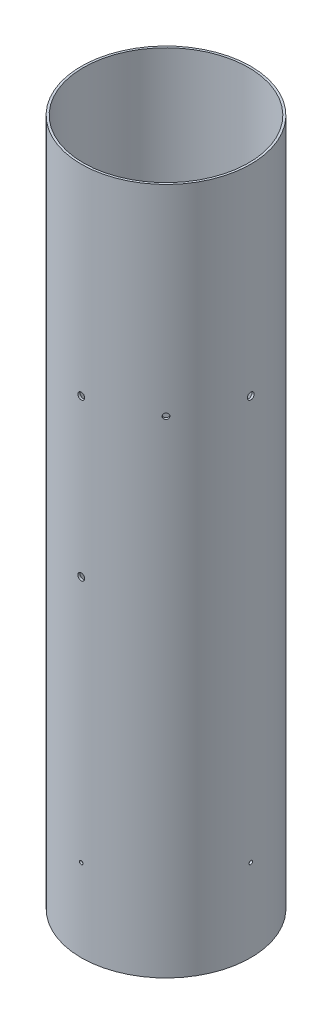
from build123d import *

# Parameters (mm, degrees)
SKETCH2_R                      = 78.359
SKETCH2_R_2                    = 76.3651
BOSS_EXTRUDE1_DEPTH            = 635
SKETCH4_R                      = 3.175
CUT_EXTRUDE2_DEPTH             = 645.59697933
CIRPATTERN2_COUNT              = 4
CUT_EXTRUDE3_REACH             = 664.58
CUT_EXTRUDE3_END_RADIUS        = 76.3651
SKETCH5_R                      = 2.57937
CUT_EXTRUDE3_DIRECTION_2_DEPTH = 663.580045892
CUT_EXTRUDE4_DEPTH             = 645.596979453
CUT_EXTRUDE4_DEPTH_BACK        = 645.596979453
SKETCH6_R                      = 3.175
CIRPATTERN3_COUNT              = 4


with BuildPart() as part:
    # Sketch2 → Boss-Extrude1 (new body)
    with BuildSketch(Plane(origin=(0, 0, 0), x_dir=(1, 0, 0), z_dir=(0, 1, 0))):
        Circle(SKETCH2_R)
        Circle(SKETCH2_R_2, mode=Mode.SUBTRACT)
    extrude(amount=BOSS_EXTRUDE1_DEPTH)

    # Sketch4 → Cut-Extrude2 (cut, symmetric)
    with BuildSketch(Plane.XY):
        with Locations((0, 449.5038)):
            Circle(SKETCH4_R)
    cut_extrude2 = extrude(amount=CUT_EXTRUDE2_DEPTH, both=True, mode=Mode.SUBTRACT)

    # CirPattern2: Cut-Extrude2 ×4 about axis
    cirpattern2_axis = Axis((0, 635, 0), (0, 1, 0))
    for i in range(1, CIRPATTERN2_COUNT):
        add(cut_extrude2.rotate(cirpattern2_axis, i * 360 / CIRPATTERN2_COUNT), mode=Mode.SUBTRACT)

    # Cut-Extrude3: up to this cylinder (the profile starts outside it)
    cut_extrude3_end = Plane(origin=(0, 449.5038, 0), z_dir=(0, -1, 0)) * Cylinder(CUT_EXTRUDE3_END_RADIUS, 1482.8902, mode=Mode.PRIVATE)
    # Sketch5 → Cut-Extrude3 (cut, up to the surface)
    with BuildSketch(Plane(origin=(55.408180267, 0, 55.408180267), x_dir=(0, -1, 0), z_dir=(0.7071067811865488, 0, 0.7071067811865464)), mode=Mode.PRIVATE) as cut_extrude3_sk1:
        with Locations((-449.5038, 0)):
            Circle(SKETCH5_R)
    cut_extrude3_tool1 = extrude(cut_extrude3_sk1.sketch, amount=-CUT_EXTRUDE3_REACH, mode=Mode.PRIVATE) - cut_extrude3_end
    add(cut_extrude3_tool1.solids().sort_by_distance((55.40818, 449.5038, 55.40818))[0], mode=Mode.SUBTRACT)

    # Sketch5 → Cut-Extrude3 direction 2 (cut)
    with BuildSketch(Plane(origin=(55.408180267, 0, 55.408180267), x_dir=(0, -1, 0), z_dir=(0.7071067811865488, 0, 0.7071067811865464))):
        with Locations((-449.5038, 0)):
            Circle(SKETCH5_R)
    extrude(amount=CUT_EXTRUDE3_DIRECTION_2_DEPTH, mode=Mode.SUBTRACT)

    # Sketch6 → Cut-Extrude4 (cut, two sides: drawn at the far end of the back side and taken through both)
    with BuildSketch(Plane.XY.offset(-CUT_EXTRUDE4_DEPTH_BACK)):
        with Locations((0, 304.8)):
            Circle(SKETCH6_R)
    extrude(amount=CUT_EXTRUDE4_DEPTH + CUT_EXTRUDE4_DEPTH_BACK, mode=Mode.SUBTRACT)

    # Sketch8 → #4 Clearance Hole1 (revolve, cut)
    with BuildSketch(Plane(origin=(0, 76.2, 78.359), x_dir=(0, -1, 0), z_dir=(1, 0, 0))):
        Polygon((0, 0), (0, 5.806574487), (1.63195, 4.826), (1.63195, 0), align=None)
    f_4_clearance_hole1 = revolve(axis=Axis((0, 76.2, 84.709), (0, 0, -1)), mode=Mode.SUBTRACT)

    # CirPattern3: #4 Clearance Hole1 ×4 about axis
    cirpattern3_axis = Axis((0, 0, 0), (0, 1, 0))
    for i in range(1, CIRPATTERN3_COUNT):
        add(f_4_clearance_hole1.rotate(cirpattern3_axis, i * 360 / CIRPATTERN3_COUNT), mode=Mode.SUBTRACT)


solid = part.part
